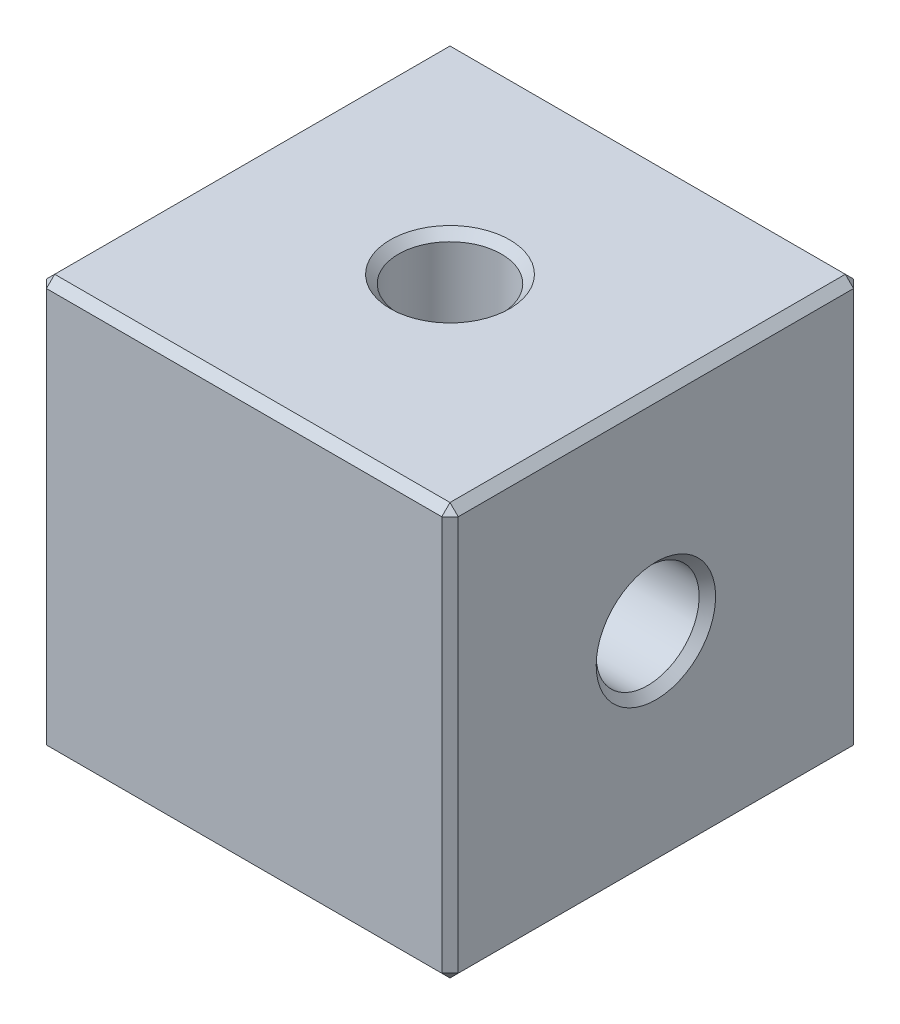
from build123d import *

# Parameters (mm, degrees)
SKETCH_1_W                   = 10
SKETCH_1_H                   = 10
EXTRUDE_1_DEPTH              = 5
HOLE_START                   = 1.25
HOLE_WIZARD_M3_2_OUTLINE_R   = 1.25
HOLE_WIZARD_M3_2_DEPTH       = 3.75
HOLE_START_2                 = -1.2500001
HOLE_WIZARD_M3_2_2_OUTLINE_R = 1.25
HOLE_WIZARD_M3_2_2_DEPTH     = 2.5000001
HOLE_WIZARD_M3_2_3_OUTLINE_W = 6
HOLE_WIZARD_M3_2_3_OUTLINE_H = 6
HOLE_WIZARD_M3_2_3_DEPTH     = 3
HOLE_WIZARD_M3_3_REACH       = 14.247
HOLE_WIZARD_M3_3_BORE_R      = 1.25
CHAMFER_1_SIZE               = 0.2


with BuildPart() as part:
    # 草图1 → 凸台-拉伸1 (new, symmetric)
    with BuildSketch(Plane(origin=(0, 0, 0), x_dir=(1, 0, 0), z_dir=(0, 1, 0))):
        Rectangle(SKETCH_1_W, SKETCH_1_H)
    extrude(amount=EXTRUDE_1_DEPTH, both=True)

    # M3 螺纹孔2: read off the stored shape, not the designer's step
    # M3 螺纹孔2 outline → M3 螺纹孔2 (cut)
    with BuildSketch(Plane(origin=(0, 0, 0), x_dir=(1, 0, 0), z_dir=(0, 1, 0)).offset(HOLE_START)):
        Circle(HOLE_WIZARD_M3_2_OUTLINE_R)
    extrude(amount=HOLE_WIZARD_M3_2_DEPTH, mode=Mode.SUBTRACT)

    # Hole Wizard M3 _2 2 outline → Hole Wizard M3 _2 2 (cut)
    with BuildSketch(Plane(origin=(0, 0, 0), x_dir=(1, 0, 0), z_dir=(0, 1, 0)).offset(HOLE_START_2)):
        Circle(HOLE_WIZARD_M3_2_2_OUTLINE_R)
    extrude(amount=HOLE_WIZARD_M3_2_2_DEPTH, mode=Mode.SUBTRACT)

    # Hole Wizard M3 _2 3 outline → Hole Wizard M3 _2 3 (add)
    with BuildSketch(Plane(origin=(0, 0, 0), x_dir=(0.707106781186548, 0.707106781186547, 0), z_dir=(0.707106781186547, -0.707106781186548, 0))):
        Rectangle(HOLE_WIZARD_M3_2_3_OUTLINE_W, HOLE_WIZARD_M3_2_3_OUTLINE_H)
    extrude(amount=HOLE_WIZARD_M3_2_3_DEPTH)

    # M3 螺纹孔3 bore → M3 螺纹孔3 (cut, up to next)
    with BuildSketch(Plane(origin=(5, 0, 0), x_dir=(0, 0, -1), z_dir=(1, 0, 0)), mode=Mode.PRIVATE) as hole_wizard_m3_3_sk1:
        Circle(HOLE_WIZARD_M3_3_BORE_R)
    hole_wizard_m3_3_tool1 = extrude(hole_wizard_m3_3_sk1.sketch, amount=-HOLE_WIZARD_M3_3_REACH, mode=Mode.PRIVATE) & part.part
    add(hole_wizard_m3_3_tool1.solids().sort_by_distance((5, 0, 0))[0], mode=Mode.SUBTRACT)

    # 倒角1
    chamfer_1_edges = [part.edges().sort_by_distance(p)[0] for p in [
        (-5, 5, 0),
        (-1.25, 5, 0),
        (0, 5, 5),
        (5, 0, 1.25),
        (5, 5, 0),
        (0, -5, 5),
        (-5, -5, 0),
        (0, -5, -5),
        (5, -5, 0),
        (5, 0, 5),
        (-5, 0, 5),
        (-5, 0, -5),
        (5, 0, -5),
        (0, 5, -5),
    ]]
    chamfer(chamfer_1_edges, length=CHAMFER_1_SIZE)


solid = part.part
